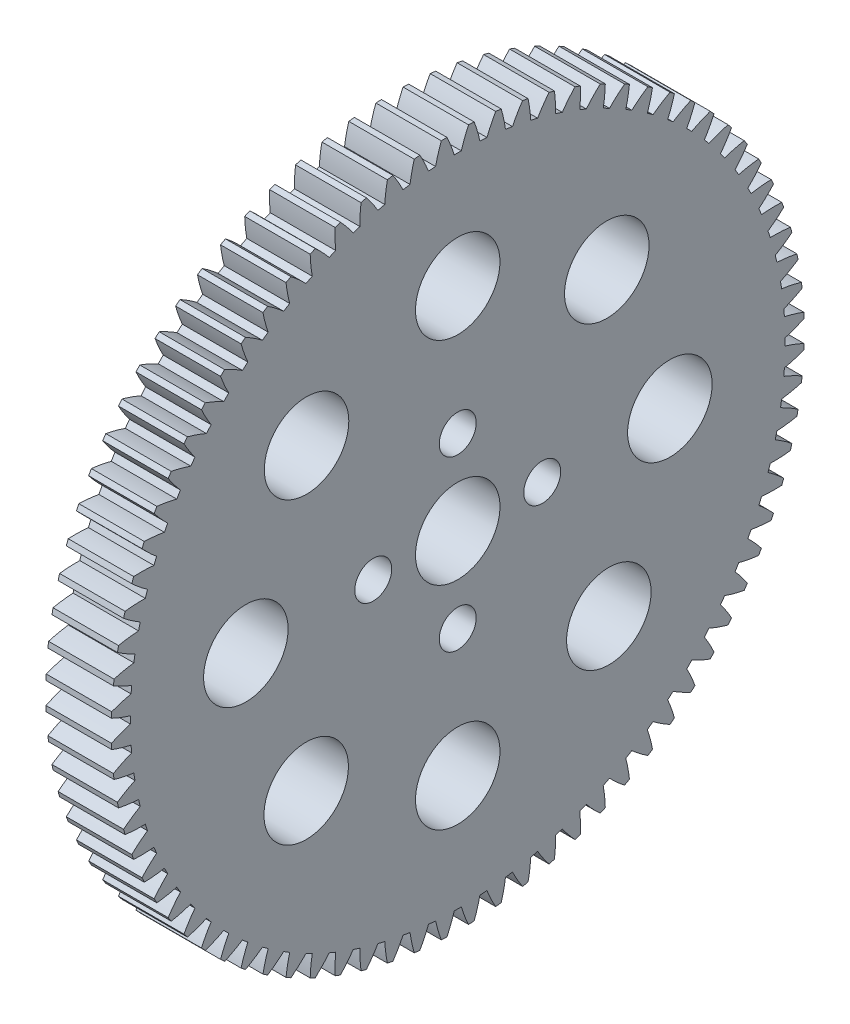
from build123d import *

# Parameters (mm, degrees)
BASPROSKE_W        = 6.2
BASPROSKE_H        = 32.8
TOOTHCUT_DEPTH     = 47.798717931
TEETHCUTS_COUNT    = 80
TEETHCUTS_ANGLE    = 355.5
BORSKE_R           = 4
BORE_DEPTH         = 50.0000508
SKETCH1_R          = 4
SKETCH1_R_2        = 1.75
CUT_EXTRUDE1_DEPTH = 47.776337838


with BuildPart() as part:
    # BasProSke → Base-Revolve (revolve)
    with BuildSketch(Plane(origin=(0, 0, 0), x_dir=(1, 0, 0), z_dir=(0, 1, 0))):
        with Locations((3.1, 16.4)):
            Rectangle(BASPROSKE_W, BASPROSKE_H)
    revolve(axis=Axis((-10, 0, 0), (1, 0, 0)))

    # TooCutSke → ToothCut (cut, through all)
    with BuildSketch(Plane(origin=(0, 0, 0), x_dir=(0, 0, -1), z_dir=(1, 0, 0))):
        with BuildLine():
            ThreePointArc((0.335706178, 30.997182168), (0, 30.999), (-0.335706178, 30.997182168))
            ThreePointArc((-0.335706178, 30.997182168), (-0.651023397, 31.916413715), (-1.035171918, 32.809073505))
            ThreePointArc((-1.035171918, 32.809073505), (0, 32.8254), (1.035171918, 32.809073505))
            ThreePointArc((1.035171918, 32.809073505), (0.651023397, 31.916413715), (0.335706178, 30.997182168))
        make_face()
    toothcut = extrude(amount=TOOTHCUT_DEPTH, mode=Mode.SUBTRACT)

    # TeethCuts: ToothCut ×80 about axis
    teethcuts_axis = Axis((-10, 0, 0), (1, 0, 0))
    for i in range(1, TEETHCUTS_COUNT):
        add(toothcut.rotate(teethcuts_axis, i * TEETHCUTS_ANGLE / (TEETHCUTS_COUNT - 1)), mode=Mode.SUBTRACT)

    # BorSke → Bore (cut, symmetric)
    with BuildSketch(Plane(origin=(0, 0, 0), x_dir=(0, 0, -1), z_dir=(1, 0, 0))):
        Circle(BORSKE_R)
    extrude(amount=BORE_DEPTH, both=True, mode=Mode.SUBTRACT)

    # Sketch1 → Cut-Extrude1 (cut, through all)
    with BuildSketch(Plane(origin=(6.2, 0, 0), x_dir=(0, 0, -1), z_dir=(1, 0, 0))):
        with Locations((0, 20.084034083)):
            Circle(SKETCH1_R)
        with Locations((0, -20.063257749)):
            Circle(SKETCH1_R)
        with Locations((20.084034083, 0)):
            Circle(SKETCH1_R)
        with Locations((-20.063257749, 0)):
            Circle(SKETCH1_R)
        with Locations((14.112602443, 14.36634376)):
            Circle(SKETCH1_R)
        with Locations((14.306921905, -14.14202094)):
            Circle(SKETCH1_R)
        with Locations((-14.348299993, -14.135100494)):
            Circle(SKETCH1_R)
        with Locations((-14.315040904, 14.159703758)):
            Circle(SKETCH1_R)
        with Locations((0, 8)):
            Circle(SKETCH1_R_2)
        with Locations((0, -8)):
            Circle(SKETCH1_R_2)
        with Locations((8, 0)):
            Circle(SKETCH1_R_2)
        with Locations((-8, 0)):
            Circle(SKETCH1_R_2)
    extrude(amount=-CUT_EXTRUDE1_DEPTH, mode=Mode.SUBTRACT)


solid = part.part
